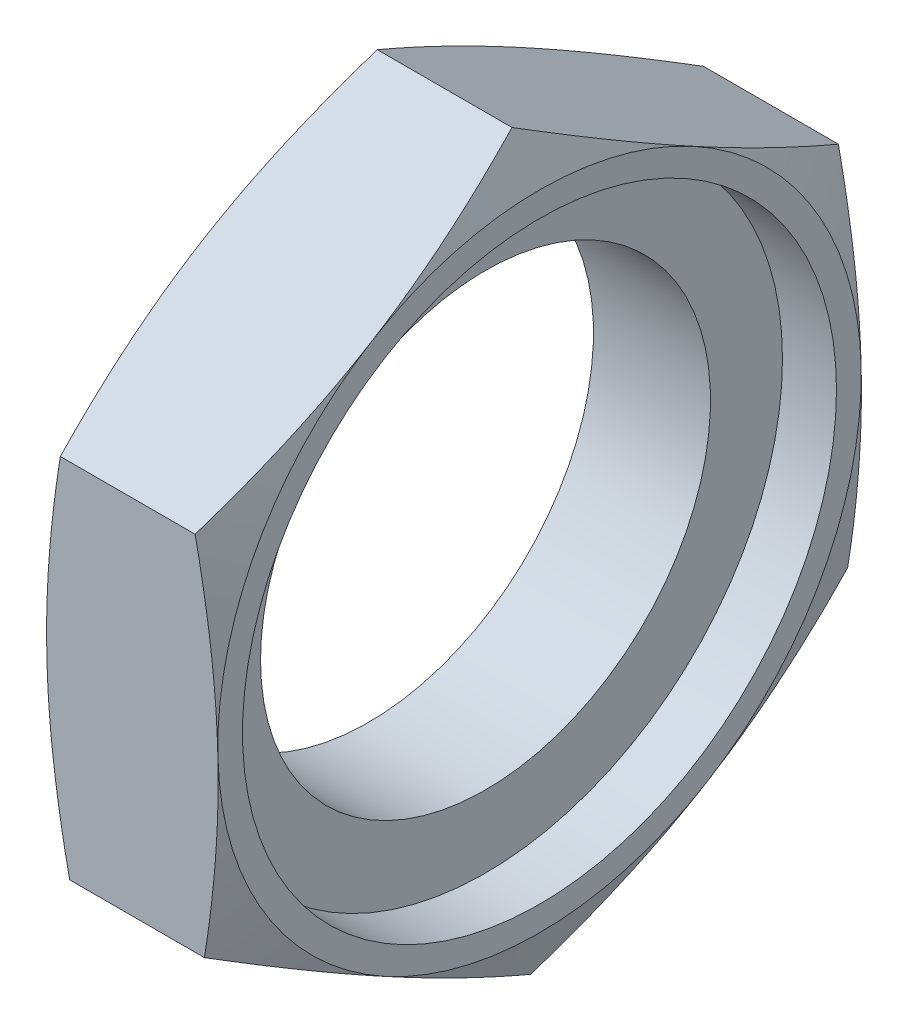
from build123d import *

# Parameters (mm, degrees)
ESBO_O1_R                = 10
RESSALTO_EXTRUS_O1_DEPTH = 7.6
FURO1_D                  = 26.4
FURO1_DEPTH              = 2.4
ESBO_O7_OUTSIDE_W        = 111.36
ESBO_O7_OUTSIDE_H        = 115.368
ESBO_O7_OUTSIDE_R        = 14.3
CORTE_EXTRUS_O1_DEPTH    = 13
CORTE_EXTRUS_O1_DRAFT    = -70
ESBO_O8_OUTSIDE_W        = 111.36
ESBO_O8_OUTSIDE_H        = 115.368
ESBO_O8_OUTSIDE_R        = 14.3
CORTE_EXTRUS_O2_DEPTH    = 13
CORTE_EXTRUS_O2_DRAFT    = -70


with BuildPart() as part:
    # Esboço1 → Ressalto-extrusão1 (new body)
    with BuildSketch(Plane(origin=(0, 0, 0), x_dir=(0, 0, -1), z_dir=(1, 0, 0))):
        Polygon((14.087474947, 8.613732232), (-0.415973461, 16.506977295), (-14.503448407, 7.893245063), (-14.087474947, -8.613732232), (0.415973461, -16.506977295), (14.503448407, -7.893245063), align=None)
        Circle(ESBO_O1_R, mode=Mode.SUBTRACT)
    extrude(amount=RESSALTO_EXTRUS_O1_DEPTH)

    # Furo1
    with Locations(Plane(origin=(7.6, 0, 0), x_dir=(0, 0, -1), z_dir=(1, 0, 0))):
        with Locations((0, 0)):
            Hole(FURO1_D / 2, depth=FURO1_DEPTH)


with BuildPart() as corte_extrus_o1_tool:
    # Esboço7 outside → Corte-extrusão1 (with draft: the straight prism first)
    with BuildSketch(Plane(origin=(7.6, 0, 0), x_dir=(0, 0, -1), z_dir=(1, 0, 0))):
        Rectangle(ESBO_O7_OUTSIDE_W, ESBO_O7_OUTSIDE_H)
        Circle(ESBO_O7_OUTSIDE_R, mode=Mode.SUBTRACT)
    extrude(amount=-CORTE_EXTRUS_O1_DEPTH)
    # Corte-extrusão1: the draft: its side faces are tilted about the plane it starts from
    corte_extrus_o1_sides = [corte_extrus_o1_tool.faces().sort_by_distance(p)[0] for p in [
        (1.1, -57.684, 0),
        (1.1, 0, -55.68),
        (1.1, 57.684, 0),
        (1.1, 0, 55.68),
        (1.1, 0, 14.3),
    ]]
    draft(corte_extrus_o1_sides, Plane(origin=(7.6, 0, 0), x_dir=(0, 0, -1), z_dir=(1, 0, 0)), CORTE_EXTRUS_O1_DRAFT)


with BuildPart() as part_1:
    add(part.part)

    # Corte-extrusão1: cut by corte_extrus_o1_tool
    add(corte_extrus_o1_tool.part, mode=Mode.SUBTRACT)


with BuildPart() as corte_extrus_o2_tool:
    # Esboço8 outside → Corte-extrusão2 (with draft: the straight prism first)
    with BuildSketch(Plane.ZY):
        Rectangle(ESBO_O8_OUTSIDE_W, ESBO_O8_OUTSIDE_H)
        Circle(ESBO_O8_OUTSIDE_R, mode=Mode.SUBTRACT)
    extrude(amount=-CORTE_EXTRUS_O2_DEPTH)
    # Corte-extrusão2: the draft: its side faces are tilted about the plane it starts from
    corte_extrus_o2_sides = [corte_extrus_o2_tool.faces().sort_by_distance(p)[0] for p in [
        (6.5, -57.684, 0),
        (6.5, 0, 55.68),
        (6.5, 57.684, 0),
        (6.5, 0, -55.68),
        (6.5, 0, -14.3),
    ]]
    draft(corte_extrus_o2_sides, Plane.ZY, CORTE_EXTRUS_O2_DRAFT)


with BuildPart() as part_2:
    add(part_1.part)

    # Corte-extrusão2: cut by corte_extrus_o2_tool
    add(corte_extrus_o2_tool.part, mode=Mode.SUBTRACT)


solid = part_2.part
